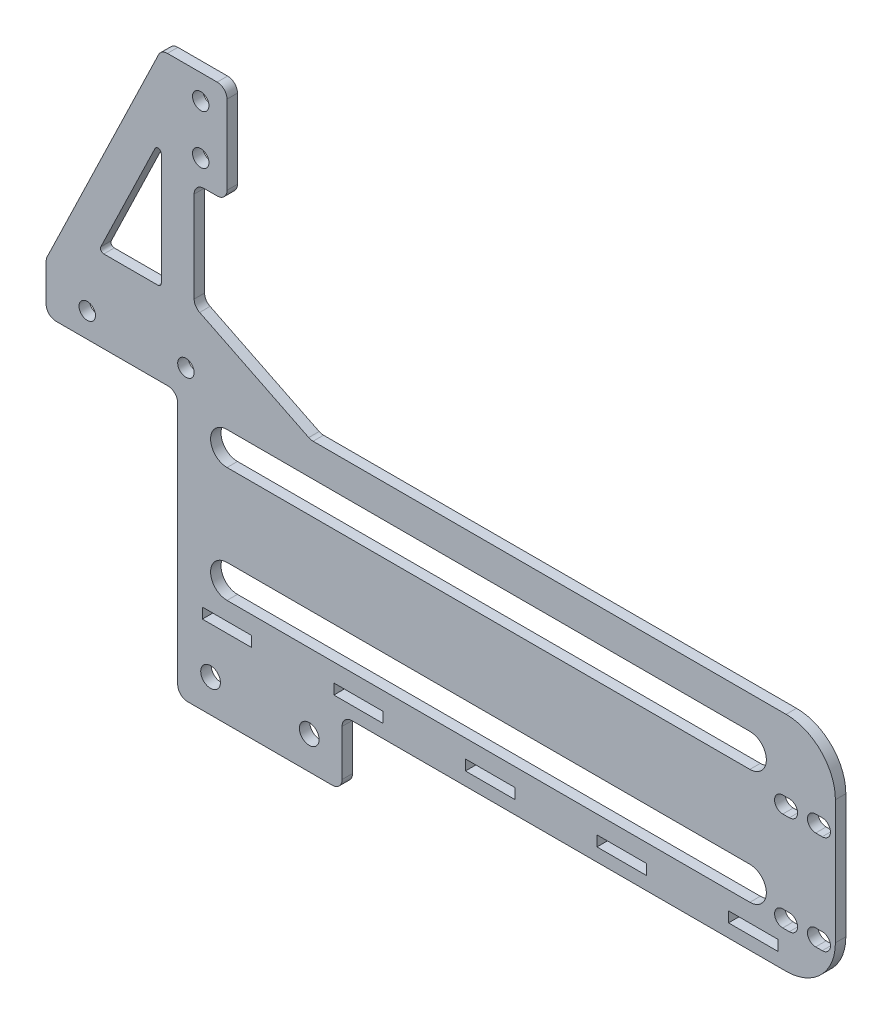
from build123d import *

# Parameters (mm, degrees)
SKETCH1_R           = 3
SKETCH1_R_2         = 2.5
SKETCH1_W           = 15
SKETCH1_H           = 3.175
BASE_FLANGE1_DEPTH  = 3.175
CUT_EXTRUDE1_DEPTH  = 10
SKETCH3_W           = 10
SKETCH3_H           = 30
BOSS_EXTRUDE1_DEPTH = 3.175
FILLET2_R           = 3
FILLET1_R           = 15
FILLET3_R           = 1
SKETCH4_R           = 2.5
CUT_EXTRUDE2_DEPTH  = 10
SKETCH5_W           = 6.305242908
SKETCH5_H           = 6.547752252
BOSS_EXTRUDE2_DEPTH = 3.175


# Sheet-metal steps are written as plain solids
with BuildPart() as part:
    # Sketch1 → Base-Flange1 (new body)
    with BuildSketch(Plane.XY):
        Polygon((-4.193265857, -88), (25.47, -95.5), (185, -95.5), (185, -143.5), (185, -148.5), (185, -163.175), (35, -163.175), (35, -183.175), (-15, -183.175), (-15, -163.175), (-15, -150.03), (-15, -103), (-55, -103), (-55, -88), align=None)
        with Locations((-5, -173.175)):
            Circle(SKETCH1_R, mode=Mode.SUBTRACT)
        with Locations((25, -173.175)):
            Circle(SKETCH1_R, mode=Mode.SUBTRACT)
        with Locations((-42.5, -95.5)):
            Circle(SKETCH1_R_2, mode=Mode.SUBTRACT)
        with Locations((-12.5, -95.5)):
            Circle(SKETCH1_R_2, mode=Mode.SUBTRACT)
        with Locations((160, -157.5875)):
            Rectangle(SKETCH1_W, SKETCH1_H, mode=Mode.SUBTRACT)
        with Locations((40, -157.5875)):
            Rectangle(SKETCH1_W, SKETCH1_H, mode=Mode.SUBTRACT)
        with Locations((0, -157.5875)):
            Rectangle(SKETCH1_W, SKETCH1_H, mode=Mode.SUBTRACT)
        with Locations((80, -157.5875)):
            Rectangle(SKETCH1_W, SKETCH1_H, mode=Mode.SUBTRACT)
        with Locations((120, -157.5875)):
            Rectangle(SKETCH1_W, SKETCH1_H, mode=Mode.SUBTRACT)
        with BuildLine():
            Line((181, -122.25), (179, -122.25))
            ThreePointArc((179, -122.25), (176.5, -119.75), (179, -117.25))
            Line((179, -117.25), (181, -117.25))
            ThreePointArc((181, -117.25), (183.5, -119.75), (181, -122.25))
        make_face(mode=Mode.SUBTRACT)
        with BuildLine():
            Line((171, -122.25), (169, -122.25))
            ThreePointArc((169, -122.25), (166.5, -119.75), (169, -117.25))
            Line((169, -117.25), (171, -117.25))
            ThreePointArc((171, -117.25), (173.5, -119.75), (171, -122.25))
        make_face(mode=Mode.SUBTRACT)
        with BuildLine():
            Line((171, -147.25), (169, -147.25))
            ThreePointArc((169, -147.25), (166.5, -149.75), (169, -152.25))
            Line((169, -152.25), (171, -152.25))
            ThreePointArc((171, -152.25), (173.5, -149.75), (171, -147.25))
        make_face(mode=Mode.SUBTRACT)
        with BuildLine():
            Line((181, -147.25), (179, -147.25))
            ThreePointArc((179, -147.25), (176.5, -149.75), (179, -152.25))
            Line((179, -152.25), (181, -152.25))
            ThreePointArc((181, -152.25), (183.5, -149.75), (181, -147.25))
        make_face(mode=Mode.SUBTRACT)
    extrude(amount=-BASE_FLANGE1_DEPTH)

    # Sketch2 → Cut-Extrude1 (cut)
    with BuildSketch(Plane.XY):
        with BuildLine():
            Line((0, -105.5), (159, -105.5))
            ThreePointArc((159, -105.5), (164, -110.5), (159, -115.5))
            Line((159, -115.5), (0, -115.5))
            ThreePointArc((0, -115.5), (-5, -110.5), (0, -105.5))
        make_face()
        with BuildLine():
            Line((0, -140.5), (159, -140.5))
            ThreePointArc((159, -140.5), (164, -145.5), (159, -150.5))
            Line((159, -150.5), (0, -150.5))
            ThreePointArc((0, -150.5), (-5, -145.5), (0, -140.5))
        make_face()
    extrude(amount=-CUT_EXTRUDE1_DEPTH, mode=Mode.SUBTRACT)

    # Sketch3 → Boss-Extrude1 (add)
    # profile 1 of 3: a face of its own
    with BuildSketch(Plane.XY):
        Polygon((-20, -15.5), (-55, -88), (-10, -88), (-10, -78), (-10, -45.5), (-10, -15.5), align=None)
        Polygon((-20, -38.501774554), (-20, -78), (-39.068108836, -78), align=None, mode=Mode.SUBTRACT)
    # profile 2 of 3: a face of its own
    with BuildSketch(Plane.XY):
        Polygon((-10, -78), (-10, -88), (25.47, -95.5), align=None)
    # profile 3 of 3: a face of its own
    with BuildSketch(Plane.XY):
        with Locations((-5, -30.5)):
            Rectangle(SKETCH3_W, SKETCH3_H)
    extrude(amount=-BOSS_EXTRUDE1_DEPTH)

    # Fillet2
    fillet2_edges = [part.edges().sort_by_distance(p)[0] for p in [
        (25.47, -95.5, -1.5875),
        (35, -163.175, -1.5875),
        (35, -183.175, -1.5875),
        (-15, -183.175, -1.5875),
        (-15, -103, -1.5875),
        (-55, -103, -1.5875),
        (-55, -88, -1.5875),
        (0, -45.5, -1.5875),
        (0, -15.5, -1.5875),
        (-20, -15.5, -1.5875),
        (-10, -78, -1.5875),
        (-10, -45.5, -1.5875),
    ]]
    fillet(fillet2_edges, radius=FILLET2_R)

    # Fillet1
    fillet1_edges = [part.edges().sort_by_distance(p)[0] for p in [
        (185, -95.5, -1.5875),
        (185, -163.175, -1.5875),
    ]]
    fillet(fillet1_edges, radius=FILLET1_R)

    # Fillet3
    fillet3_edges = [part.edges().sort_by_distance(p)[0] for p in [
        (-20, -78, -1.5875),
        (-39.068108836, -78, -1.5875),
        (-20, -38.501774554, -1.5875),
    ]]
    fillet(fillet3_edges, radius=FILLET3_R)

    # Sketch4 → Cut-Extrude2 (cut)
    with BuildSketch(Plane.XY):
        with Locations((-8, -23)):
            Circle(SKETCH4_R)
        with Locations((-8, -38)):
            Circle(SKETCH4_R)
    extrude(amount=-CUT_EXTRUDE2_DEPTH, mode=Mode.SUBTRACT)

    # Sketch5 → Boss-Extrude2 (add)
    with BuildSketch(Plane.XY):
        with Locations((-8.695694073, -86.656931436)):
            Rectangle(SKETCH5_W, SKETCH5_H)
    extrude(amount=-BOSS_EXTRUDE2_DEPTH)


solid = part.part
